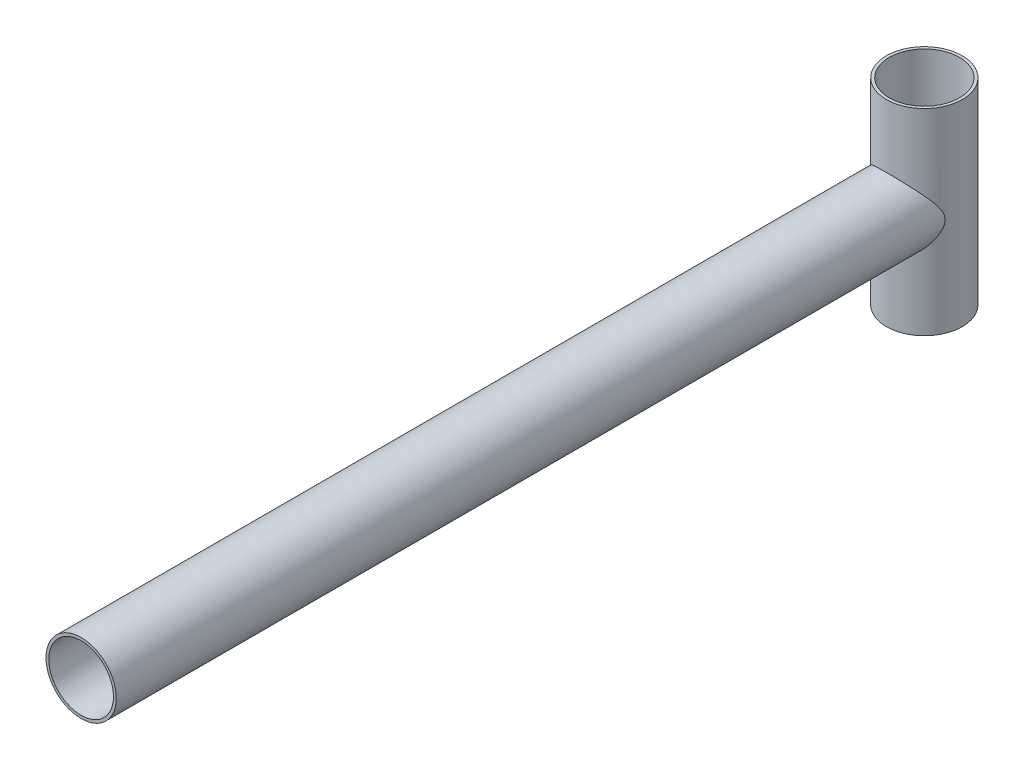
from build123d import *

# Parameters (mm, degrees)
SKETCH1_R           = 13.5
BOSS_EXTRUDE1_DEPTH = 35
SKETCH2_R           = 12.5
BOSS_EXTRUDE2_DEPTH = 300
SHELL1_T            = -1


with BuildPart() as part:
    # Sketch1 → Boss-Extrude1 (new, symmetric)
    with BuildSketch(Plane(origin=(0, 0, 0), x_dir=(1, 0, 0), z_dir=(0, 1, 0))):
        Circle(SKETCH1_R)
    extrude(amount=BOSS_EXTRUDE1_DEPTH, both=True)

    # Sketch2 → Boss-Extrude2 (add)
    with BuildSketch(Plane.XY):
        Circle(SKETCH2_R)
    extrude(amount=BOSS_EXTRUDE2_DEPTH)

    # Shell1
    shell1_openings = [part.faces().sort_by_distance(p)[0] for p in [
        (0, 35, 0),
        (0, 0, 300),
        (0, -35, 0),
    ]]
    offset(amount=SHELL1_T, openings=shell1_openings, kind=Kind.INTERSECTION)


solid = part.part
